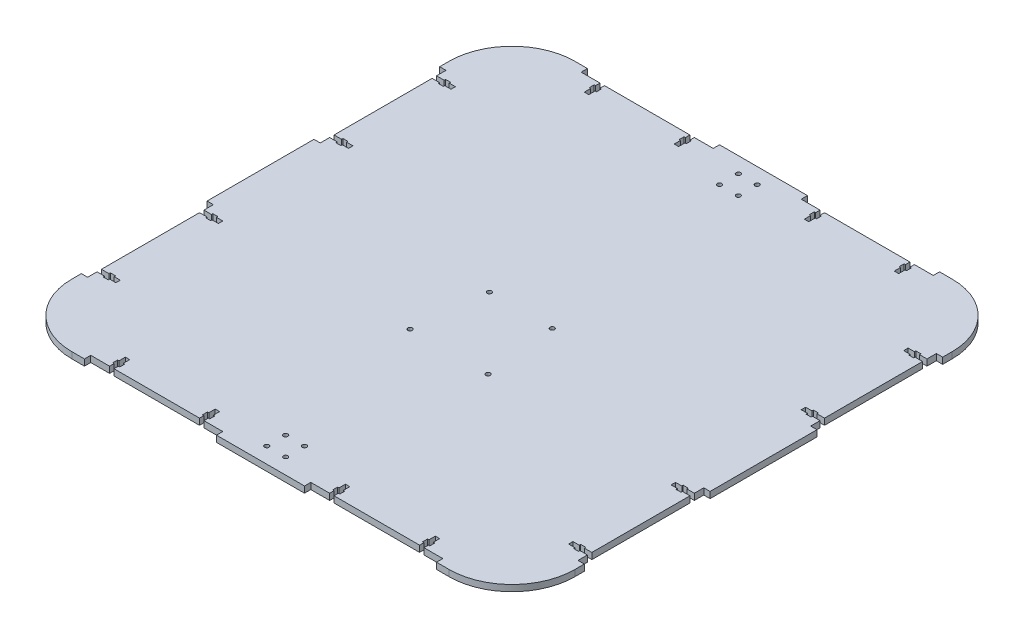
from build123d import *

# Parameters (mm, degrees)
SKETCH1_W           = 400
SKETCH1_H           = 400
SKETCH1_R           = 1.75
BOSS_EXTRUDE2_DEPTH = 5
FILLET1_R           = 50
CUT_EXTRUDE8_DEPTH  = 10
SKETCH11_W          = 105
SKETCH11_H          = 5
CUT_EXTRUDE9_DEPTH  = 10
CUT_EXTRUDE10_DEPTH = 5
SKETCH13_W          = 5
SKETCH13_H          = 100
CUT_EXTRUDE11_DEPTH = 5
SKETCH14_R          = 1.75
CUT_EXTRUDE12_DEPTH = 10


with BuildPart() as part:
    # Sketch1 → Boss-Extrude2 (new body)
    with BuildSketch(Plane(origin=(0, 0, 0), x_dir=(1, 0, 0), z_dir=(0, 1, 0))):
        Rectangle(SKETCH1_W, SKETCH1_H)
        with Locations((-7.5, 172.5)):
            Circle(SKETCH1_R, mode=Mode.SUBTRACT)
        with Locations((-7.5, 187.5)):
            Circle(SKETCH1_R, mode=Mode.SUBTRACT)
        with Locations((7.5, 172.5)):
            Circle(SKETCH1_R, mode=Mode.SUBTRACT)
        with Locations((7.5, 187.5)):
            Circle(SKETCH1_R, mode=Mode.SUBTRACT)
        with Locations((-7.5, -187.5)):
            Circle(SKETCH1_R, mode=Mode.SUBTRACT)
        with Locations((-7.5, -172.5)):
            Circle(SKETCH1_R, mode=Mode.SUBTRACT)
        with Locations((7.5, -187.5)):
            Circle(SKETCH1_R, mode=Mode.SUBTRACT)
        with Locations((7.5, -172.5)):
            Circle(SKETCH1_R, mode=Mode.SUBTRACT)
    extrude(amount=BOSS_EXTRUDE2_DEPTH)

    # Fillet1
    fillet1_edges = [part.edges().sort_by_distance(p)[0] for p in [
        (200, 2.5, -200),
        (200, 2.5, 200),
        (-200, 2.5, 200),
        (-200, 2.5, -200),
    ]]
    fillet(fillet1_edges, radius=FILLET1_R)

    # Sketch10 → Cut-Extrude8 (cut)
    with BuildSketch(Plane(origin=(0, 5, 0), x_dir=(1, 0, 0), z_dir=(0, 1, 0))):
        Polygon((-125, -200), (-121.5, -200), (-121.5, -191.5), (-120.4, -191.5), (-120.4, -187.5), (-121.5, -187.5), (-121.5, -182.5), (-125, -182.5), (-125, -187.5), (-126.1, -187.5), (-126.1, -191.5), (-125, -191.5), align=None)
        Polygon((-53.5, -200), (-50, -200), (-50, -191.5), (-48.9, -191.5), (-48.9, -187.5), (-50, -187.5), (-50, -182.5), (-53.5, -182.5), (-53.5, -187.5), (-54.6, -187.5), (-54.6, -191.5), (-53.5, -191.5), align=None)
        Polygon((125, -200), (125, -191.5), (126.1, -191.5), (126.1, -187.5), (125, -187.5), (125, -182.5), (121.5, -182.5), (121.5, -187.5), (120.4, -187.5), (120.4, -191.5), (121.5, -191.5), (121.5, -200), align=None)
        Polygon((53.5, -200), (53.5, -191.5), (54.6, -191.5), (54.6, -187.5), (53.5, -187.5), (53.5, -182.5), (50, -182.5), (50, -187.5), (48.9, -187.5), (48.9, -191.5), (50, -191.5), (50, -200), align=None)
        Polygon((125, 200), (121.5, 200), (121.5, 191.5), (120.4, 191.5), (120.4, 187.5), (121.5, 187.5), (121.5, 182.5), (125, 182.5), (125, 187.5), (126.1, 187.5), (126.1, 191.5), (125, 191.5), align=None)
        Polygon((53.5, 200), (50, 200), (50, 191.5), (48.9, 191.5), (48.9, 187.5), (50, 187.5), (50, 182.5), (53.5, 182.5), (53.5, 187.5), (54.6, 187.5), (54.6, 191.5), (53.5, 191.5), align=None)
        Polygon((-53.5, 200), (-53.5, 191.5), (-54.6, 191.5), (-54.6, 187.5), (-53.5, 187.5), (-53.5, 182.5), (-50, 182.5), (-50, 187.5), (-48.9, 187.5), (-48.9, 191.5), (-50, 191.5), (-50, 200), align=None)
        Polygon((-125, 200), (-125, 191.5), (-126.1, 191.5), (-126.1, 187.5), (-125, 187.5), (-125, 182.5), (-121.5, 182.5), (-121.5, 187.5), (-120.4, 187.5), (-120.4, 191.5), (-121.5, 191.5), (-121.5, 200), align=None)
    extrude(amount=-CUT_EXTRUDE8_DEPTH, mode=Mode.SUBTRACT)

    # Sketch11 → Cut-Extrude9 (cut)
    with BuildSketch(Plane(origin=(0, 5, 0), x_dir=(1, 0, 0), z_dir=(0, 1, 0))):
        with Locations((-87.5, -197.5)):
            Rectangle(SKETCH11_W, SKETCH11_H)
        with Locations((87.5, -197.5)):
            Rectangle(SKETCH11_W, SKETCH11_H)
        with Locations((87.5, 197.5)):
            Rectangle(SKETCH11_W, SKETCH11_H)
        with Locations((-87.5, 197.5)):
            Rectangle(SKETCH11_W, SKETCH11_H)
    extrude(amount=-CUT_EXTRUDE9_DEPTH, mode=Mode.SUBTRACT)

    # Sketch12 → Cut-Extrude10 (cut)
    with BuildSketch(Plane(origin=(0, 5, 0), x_dir=(1, 0, 0), z_dir=(0, 1, 0))):
        Polygon((-200, 135), (-189, 135), (-189, 136.1), (-185, 136.1), (-185, 135), (-180, 135), (-180, 131.5), (-185, 131.5), (-185, 130.4), (-189, 130.4), (-189, 131.5), (-200, 131.5), align=None)
        Polygon((-200, 53.5), (-189, 53.5), (-189, 54.6), (-185, 54.6), (-185, 53.5), (-180, 53.5), (-180, 50), (-185, 50), (-185, 48.9), (-189, 48.9), (-189, 50), (-200, 50), align=None)
        Polygon((-200, -53.5), (-200, -50), (-189, -50), (-189, -48.9), (-185, -48.9), (-185, -50), (-180, -50), (-180, -53.5), (-185, -53.5), (-185, -54.6), (-189, -54.6), (-189, -53.5), align=None)
        Polygon((-200, -135), (-200, -131.5), (-189, -131.5), (-189, -130.4), (-185, -130.4), (-185, -131.5), (-180, -131.5), (-180, -135), (-185, -135), (-185, -136.1), (-189, -136.1), (-189, -135), align=None)
        Polygon((200, -135), (189, -135), (189, -136.1), (185, -136.1), (185, -135), (180, -135), (180, -131.5), (185, -131.5), (185, -130.4), (189, -130.4), (189, -131.5), (200, -131.5), align=None)
        Polygon((200, -53.5), (189, -53.5), (189, -54.6), (185, -54.6), (185, -53.5), (180, -53.5), (180, -50), (185, -50), (185, -48.9), (189, -48.9), (189, -50), (200, -50), align=None)
        Polygon((200, 53.5), (200, 50), (189, 50), (189, 48.9), (185, 48.9), (185, 50), (180, 50), (180, 53.5), (185, 53.5), (185, 54.6), (189, 54.6), (189, 53.5), align=None)
        Polygon((200, 135), (200, 131.5), (189, 131.5), (189, 130.4), (185, 130.4), (185, 131.5), (180, 131.5), (180, 135), (185, 135), (185, 136.1), (189, 136.1), (189, 135), align=None)
    extrude(amount=-CUT_EXTRUDE10_DEPTH, mode=Mode.SUBTRACT)

    # Sketch13 → Cut-Extrude11 (cut)
    with BuildSketch(Plane(origin=(0, 5, 0), x_dir=(1, 0, 0), z_dir=(0, 1, 0))):
        with Locations((-197.5, 92.5)):
            Rectangle(SKETCH13_W, SKETCH13_H)
        with Locations((-197.5, -92.5)):
            Rectangle(SKETCH13_W, SKETCH13_H)
        with Locations((197.5, -92.5)):
            Rectangle(SKETCH13_W, SKETCH13_H)
        with Locations((197.5, 92.5)):
            Rectangle(SKETCH13_W, SKETCH13_H)
    extrude(amount=-CUT_EXTRUDE11_DEPTH, mode=Mode.SUBTRACT)

    # Sketch14 → Cut-Extrude12 (cut)
    with BuildSketch(Plane(origin=(0, 5, 0), x_dir=(1, 0, 0), z_dir=(0, 1, 0))):
        with Locations((-31, -50)):
            Circle(SKETCH14_R)
        with Locations((31, -50)):
            Circle(SKETCH14_R)
        with Locations((-25, 7)):
            Circle(SKETCH14_R)
        with Locations((25, 7)):
            Circle(SKETCH14_R)
    extrude(amount=-CUT_EXTRUDE12_DEPTH, mode=Mode.SUBTRACT)


solid = part.part
